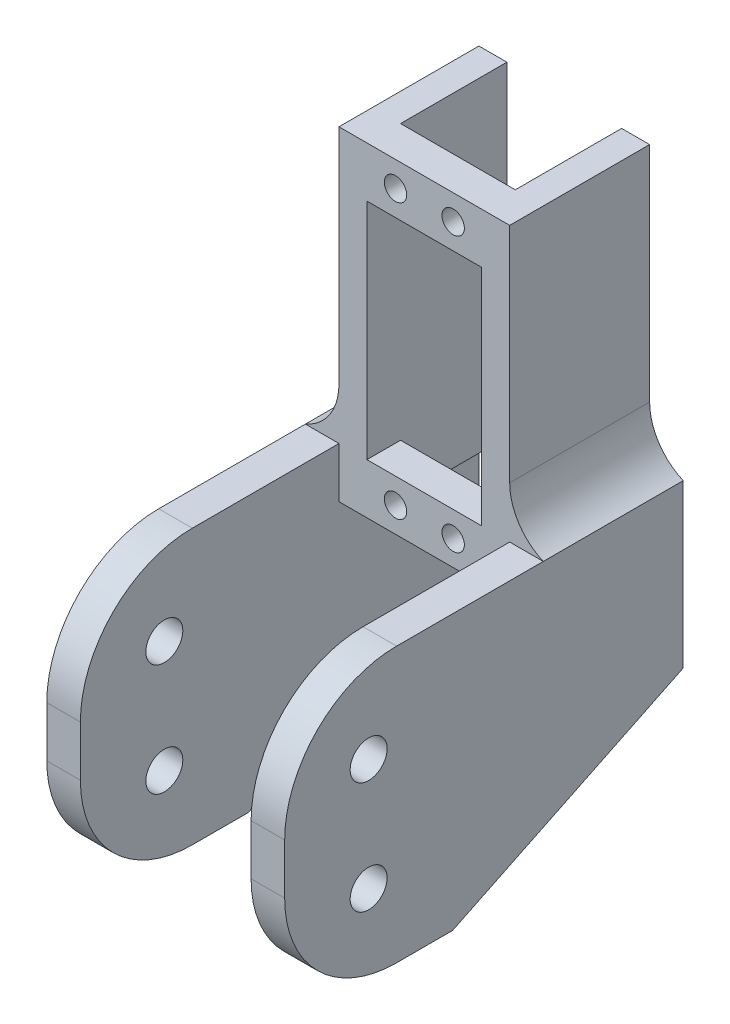
from build123d import *

# Parameters (mm, degrees)
SKETCH1_W            = 20.5
SKETCH1_H            = 9
BOSS_EXTRUDE1_DEPTH  = 6
SKETCH2_W            = 25
SKETCH2_H            = 58
BOSS_EXTRUDE2_DEPTH  = 5
LPATTERN1_COUNT      = 2
LPATTERN1_PITCH      = 49
LPATTERN2_COUNT      = 2
LPATTERN2_PITCH      = 25.5
CUT_EXTRUDE1_REACH   = 62.632
SKETCH3_R            = 2
LPATTERN3_COUNT      = 2
LPATTERN3_PITCH      = 10.3
LPATTERN3_COUNT_DIR2 = 2
LPATTERN3_PITCH_DIR2 = 49
SKETCH4_W            = 25
SKETCH4_H            = 29
BOSS_EXTRUDE3_DEPTH  = 6
LPATTERN4_COUNT      = 2
LPATTERN4_PITCH      = 36.5
SKETCH6_W            = 6
SKETCH6_H            = 29
BOSS_EXTRUDE5_DEPTH  = 46.2
FILLET1_R            = 10
M6_CLEARANCE_HOLE1_D = 6.6
SKETCH9_W            = 6
SKETCH9_H            = 30
BOSS_EXTRUDE6_DEPTH  = 20
BOSS_EXTRUDE7_DEPTH  = 6
LPATTERN5_COUNT      = 2
LPATTERN5_PITCH      = 36.5
FILLET2_R            = 20
M6_CLEARANCE_HOLE2_D = 6.6


with BuildPart() as part:
    # Sketch1 → Boss-Extrude1 (new body)
    with BuildSketch(Plane.XY):
        with Locations((10.25, 4.5)):
            Rectangle(SKETCH1_W, SKETCH1_H)
    boss_extrude1 = extrude(amount=BOSS_EXTRUDE1_DEPTH)

    # Sketch2 → Boss-Extrude2 (add)
    with BuildSketch(Plane(origin=(20.5, 0, 0), x_dir=(0, 0, -1), z_dir=(1, 0, 0))):
        with Locations((6.5, -20)):
            Rectangle(SKETCH2_W, SKETCH2_H)
    boss_extrude2 = extrude(amount=BOSS_EXTRUDE2_DEPTH)

    # LPattern1: Boss-Extrude1 ×2
    with Locations(*[(0, -i * LPATTERN1_PITCH, 0) for i in range(1, LPATTERN1_COUNT)]):
        add(boss_extrude1)

    # LPattern2: Boss-Extrude2 ×2
    with Locations(*[(-i * LPATTERN2_PITCH, 0, 0) for i in range(1, LPATTERN2_COUNT)]):
        add(boss_extrude2)

    # Sketch3 → Cut-Extrude1 (cut, up to next)
    with BuildSketch(Plane.XY.offset(6), mode=Mode.PRIVATE) as cut_extrude1_sk1:
        with Locations((5.1, 4.5)):
            Circle(SKETCH3_R)
    cut_extrude1_tool1 = extrude(cut_extrude1_sk1.sketch, amount=-CUT_EXTRUDE1_REACH, mode=Mode.PRIVATE) & part.part
    cut_extrude1 = cut_extrude1_tool1.solids().sort_by_distance((5.1, 4.5, 6))[0]
    add(cut_extrude1, mode=Mode.SUBTRACT)

    # LPattern3: Cut-Extrude1 2 × 2
    with Locations(*[(i * LPATTERN3_PITCH, -j * LPATTERN3_PITCH_DIR2, 0) for i in range(LPATTERN3_COUNT) for j in range(LPATTERN3_COUNT_DIR2) if (i, j) != (0, 0)]):
        add(cut_extrude1, mode=Mode.SUBTRACT)

    # Sketch4 → Boss-Extrude3 (add)
    with BuildSketch(Plane(origin=(25.5, 0, 0), x_dir=(0, 0, -1), z_dir=(1, 0, 0))):
        with Locations((6.5, -54.5)):
            Rectangle(SKETCH4_W, SKETCH4_H)
    boss_extrude3 = extrude(amount=BOSS_EXTRUDE3_DEPTH)

    # LPattern4: Boss-Extrude3 ×2
    with Locations(*[(-i * LPATTERN4_PITCH, 0, 0) for i in range(1, LPATTERN4_COUNT)]):
        add(boss_extrude3)

    # Sketch6 → Boss-Extrude5 (add)
    with BuildSketch(Plane.XY.offset(6)):
        with Locations((28.5, -54.5)):
            Rectangle(SKETCH6_W, SKETCH6_H)
        with Locations((-8, -54.5)):
            Rectangle(SKETCH6_W, SKETCH6_H)
    extrude(amount=BOSS_EXTRUDE5_DEPTH)

    # Fillet1
    # the kernel refuses this fillet: 10 mm, written as the material it adds along each edge
    with BuildSketch(Plane(origin=(25.5, -40, 6), x_dir=(0, 1, 0), z_dir=(0, 0, -1))) as fillet1_piece_1:
        with BuildLine():
            CenterArc((9.16515139, 10), FILLET1_R, 203.578178478, 66.421821522)
            Line((0, 6), (0, 0))
            Line((0, 0), (9.16515139, 0))
        make_face()
    extrude(amount=25)
    with BuildSketch(Plane(origin=(-5, -40, 6), x_dir=(-1, 0, 0), z_dir=(0, 0, -1))) as fillet1_piece_2:
        with BuildLine():
            CenterArc((10, 9.16515139), FILLET1_R, 180, 66.421821522)
            Line((0, 9.16515139), (0, 0))
            Line((0, 0), (6, 0))
        make_face()
    extrude(amount=25)

    # M6 Clearance Hole1 (through all)
    with Locations(Plane.ZY.offset(11)):
        with Locations((37.2, -55)):
            Hole(M6_CLEARANCE_HOLE1_D / 2)

    # Sketch9 → Boss-Extrude6 (add)
    with BuildSketch(Plane.XZ.offset(69)):
        with Locations((28.5, 37.2)):
            Rectangle(SKETCH9_W, SKETCH9_H)
        with Locations((-8, 37.2)):
            Rectangle(SKETCH9_W, SKETCH9_H)
    extrude(amount=BOSS_EXTRUDE6_DEPTH)

    # Sketch10 → Boss-Extrude7 (add)
    with BuildSketch(Plane(origin=(31.5, 0, 0), x_dir=(0, 0, -1), z_dir=(1, 0, 0))):
        Polygon((-22.2, -80.626229403), (-22.2, -89), (19, -69), (-19.89821605, -69), align=None)
        Polygon((-22.2, -69), (-22.2, -80.626229403), (-19.89821605, -69), align=None)
    boss_extrude7 = extrude(amount=-BOSS_EXTRUDE7_DEPTH)

    # LPattern5: Boss-Extrude7 ×2
    with Locations(*[(-i * LPATTERN5_PITCH, 0, 0) for i in range(1, LPATTERN5_COUNT)]):
        add(boss_extrude7)

    # Fillet2
    fillet2_edges = [part.edges().sort_by_distance(p)[0] for p in [
        (28.5, -40, 52.2),
        (-8, -40, 52.2),
        (28.5, -89, 52.2),
        (-8, -89, 52.2),
    ]]
    fillet(fillet2_edges, radius=FILLET2_R)

    # M6 Clearance Hole2 (through all)
    with Locations(Plane(origin=(31.5, 0, 0), x_dir=(0, 0, -1), z_dir=(1, 0, 0))):
        with Locations((-37.2, -75)):
            Hole(M6_CLEARANCE_HOLE2_D / 2)


solid = part.part
